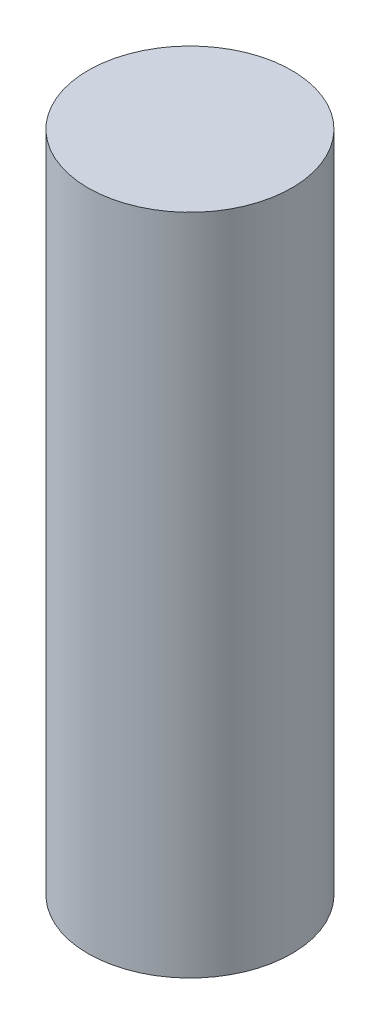
from build123d import *

# Parameters (mm, degrees)
SKETCH1_R           = 10.775
BOSS_EXTRUDE1_DEPTH = 70.15


with BuildPart() as part:
    # Sketch1 → Boss-Extrude1 (new body)
    with BuildSketch(Plane(origin=(0, 0, 0), x_dir=(1, 0, 0), z_dir=(0, 1, 0))):
        Circle(SKETCH1_R)
    extrude(amount=BOSS_EXTRUDE1_DEPTH)


solid = part.part
